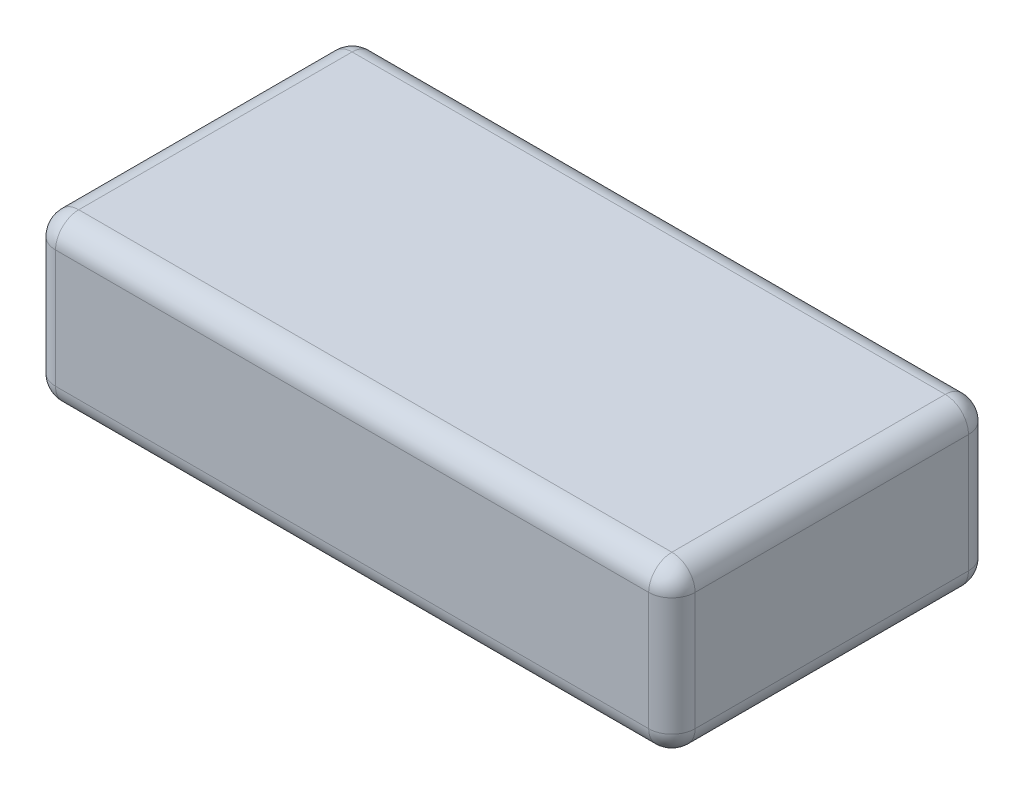
from build123d import *

# Parameters (mm, degrees)
SKETCH1_W           = 70
SKETCH1_H           = 35
BOSS_EXTRUDE1_DEPTH = 18
FILLET1_R           = 2.54


with BuildPart() as part:
    # Sketch1 → Boss-Extrude1 (new body)
    with BuildSketch(Plane(origin=(0, 0, 0), x_dir=(1, 0, 0), z_dir=(0, 1, 0))):
        with Locations((8.324917755, 5.659761329)):
            Rectangle(SKETCH1_W, SKETCH1_H)
    extrude(amount=BOSS_EXTRUDE1_DEPTH)

    # Fillet1
    fillet1_edges = [part.edges().sort_by_distance(p)[0] for p in [
        (43.324917755, 9, 11.840238671),
        (8.324917755, 0, 11.840238671),
        (43.324917755, 0, -5.659761329),
        (-26.675082245, 9, 11.840238671),
        (-26.675082245, 0, -5.659761329),
        (43.324917755, 9, -23.159761329),
        (-26.675082245, 9, -23.159761329),
        (8.324917755, 0, -23.159761329),
        (8.324917755, 18, -23.159761329),
        (43.324917755, 18, -5.659761329),
        (8.324917755, 18, 11.840238671),
        (-26.675082245, 18, -5.659761329),
    ]]
    fillet(fillet1_edges, radius=FILLET1_R)


solid = part.part
